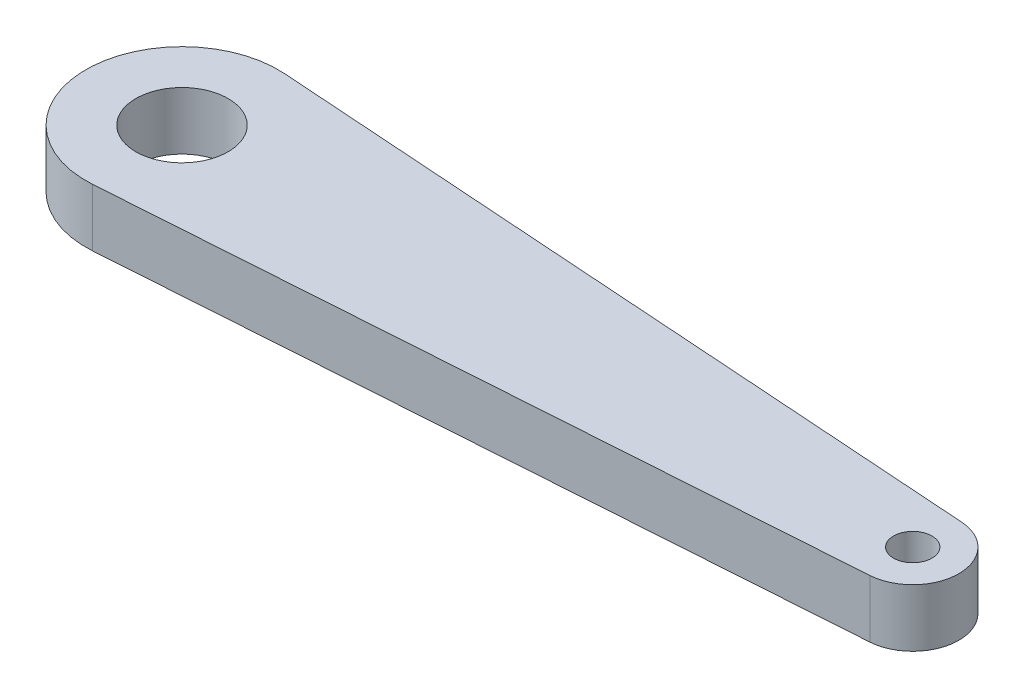
from build123d import *

# Parameters (mm, degrees)
SKETCH2_R           = 2.5
SKETCH2_R_2         = 6
BOSS_EXTRUDE1_DEPTH = 7.5


with BuildPart() as part:
    # Sketch2 → Boss-Extrude1 (new body)
    with BuildSketch(Plane(origin=(0, 0, 0), x_dir=(1, 0, 0), z_dir=(0, 1, 0))):
        with BuildLine():
            Line((-23.055314395, 12.470706673), (71.499948763, 5.985939203))
            ThreePointArc((71.499948763, 5.985939203), (77.089422447, 0), (71.499948763, -5.985939203))
            Line((71.499948763, -5.985939203), (-23.055314395, -12.470706673))
            ThreePointArc((-23.055314395, -12.470706673), (-36.410577553, 0), (-23.055314395, 12.470706673))
        make_face()
        with Locations((71.089422447, 0)):
            Circle(SKETCH2_R, mode=Mode.SUBTRACT)
        with Locations((-23.910577553, 0)):
            Circle(SKETCH2_R_2, mode=Mode.SUBTRACT)
    extrude(amount=BOSS_EXTRUDE1_DEPTH)


solid = part.part
